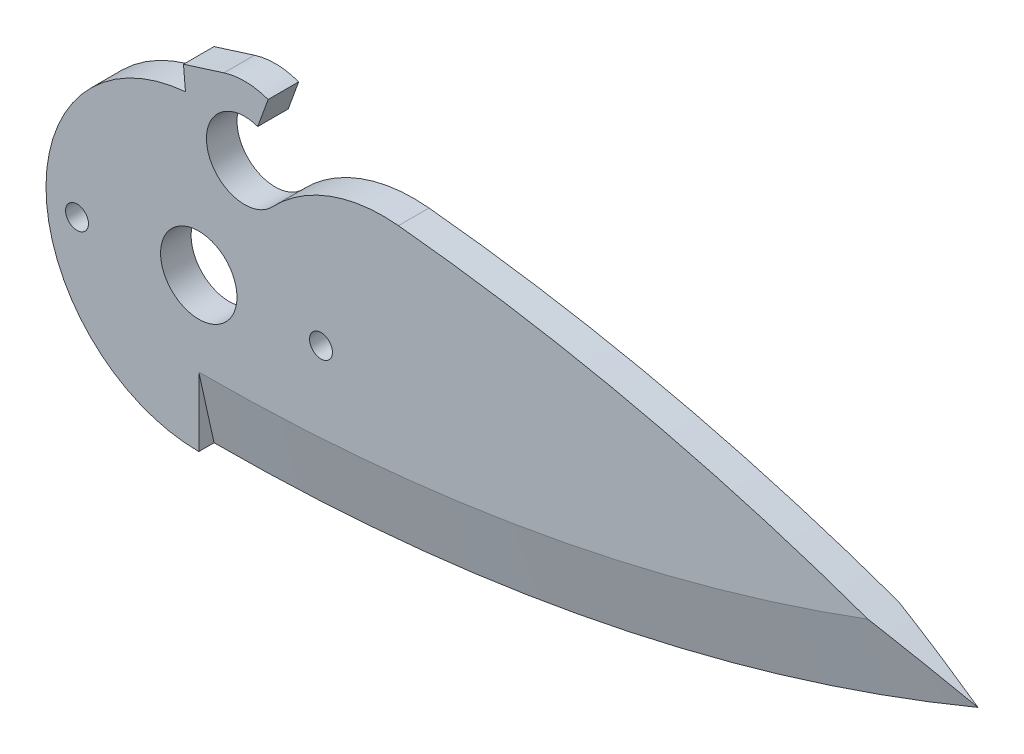
from build123d import *

# Parameters (mm, degrees)
SKICA1_R                      = 2.5
P_IDAT_VYSUNUT_M1_DEPTH       = 1
ODEBRAT_VYSUNUT_M1_DEPTH      = 52.548520832
ODEBRAT_VYSUNUT_M1_DEPTH_BACK = 52.548520832
SKICA4_R                      = 0.75


with BuildPart() as part:
    # Skica1 → Přidat vysunutím1 (new, symmetric)
    with BuildSketch(Plane.XY):
        with BuildLine():
            Line((1.646493053, 12.291621948), (-1.002291042, 11.456239028))
            Line((-1.002291042, 11.456239028), (-0.871557427, 9.961946981))
            ThreePointArc((-0.871557427, 9.961946981), (-7.372773368, 6.755902076), (-10, 0))
            ThreePointArc((-10, 0), (-7.071067812, -7.071067812), (0, -10))
            ThreePointArc((0, -10), (25.495097568, -7.47548784), (50, 0))
            ThreePointArc((50, 0), (31.878604545, 6.030768355), (13.069168565, 9.34139644))
            ThreePointArc((13.069168565, 9.34139644), (8.585652805, 8.76767337), (4.812769581, 6.27841165))
            ThreePointArc((4.812769581, 6.27841165), (0.566440986, 7.427470066), (3.855050358, 10.349231552))
            Line((3.855050358, 10.349231552), (4.539090645, 12.228616794))
            ThreePointArc((4.539090645, 12.228616794), (3.097993569, 12.498932902), (1.646493053, 12.291621948))
        make_face()
        Circle(SKICA1_R, mode=Mode.SUBTRACT)
    extrude(amount=P_IDAT_VYSUNUT_M1_DEPTH, both=True)

    # Skica4 → Odebrat vysunutím1 (cut, two sides: drawn at the far end of the back side and taken through both)
    with BuildSketch(Plane.XY.offset(-ODEBRAT_VYSUNUT_M1_DEPTH_BACK)):
        with Locations((8, 0)):
            Circle(SKICA4_R)
        with Locations((-7.969557585, -0.697245942)):
            Circle(SKICA4_R)
    extrude(amount=ODEBRAT_VYSUNUT_M1_DEPTH + ODEBRAT_VYSUNUT_M1_DEPTH_BACK, mode=Mode.SUBTRACT)

    # Odebrat tažením po křivce1: sweep along a path in Skica3
    with BuildLine(Plane.XY) as odebrat_ta_en_m_po_k_ivce1_path:
        ThreePointArc((0, -10), (25.495097568, -7.47548784), (50, 0))
    # Skica2 → Odebrat tažením po křivce1 (sweep, cut)
    with BuildSketch(Plane(origin=(0, 0, 0), x_dir=(0, 0, -1), z_dir=(1, 0, 0))):
        Polygon((0, -10), (-1, -5.489291496), (-1, -10), align=None)
    odebrat_ta_en_m_po_k_ivce1 = sweep(path=odebrat_ta_en_m_po_k_ivce1_path.line, mode=Mode.SUBTRACT)

    # Zrcadlit1: Odebrat tažením po křivce1 across plane
    add(odebrat_ta_en_m_po_k_ivce1.mirror(Plane.XY), mode=Mode.SUBTRACT)


solid = part.part
